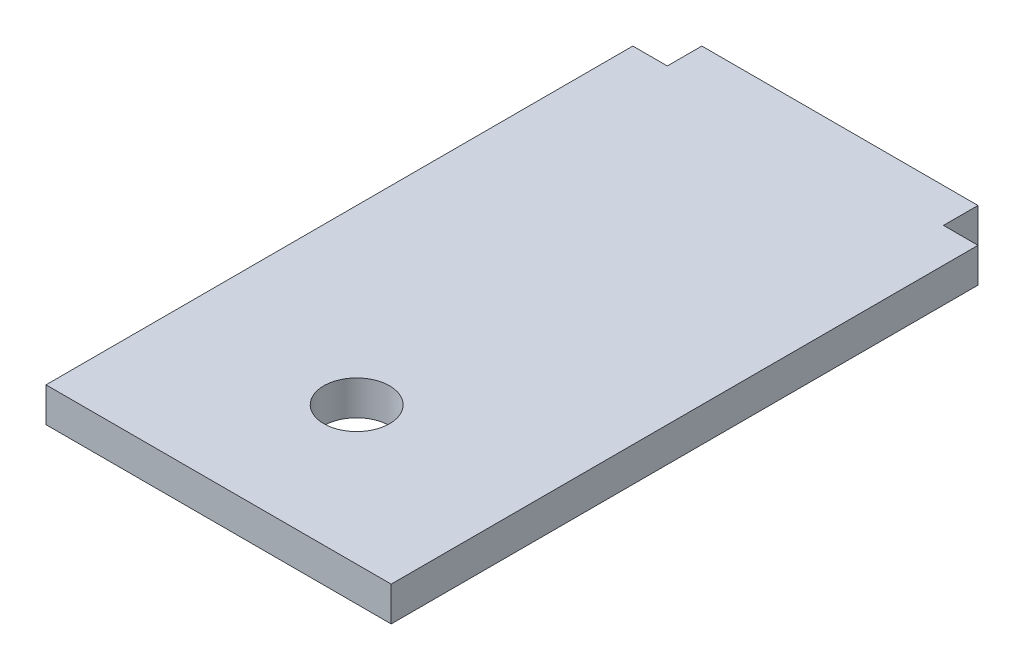
from build123d import *

# Parameters (mm, degrees)
SKETCH1_R    = 4.7625
HAMMER_DEPTH = 5


with BuildPart() as part:
    # Sketch1 → Hammer (new body)
    with BuildSketch(Plane(origin=(0, 0, 0), x_dir=(1, 0, 0), z_dir=(0, 1, 0))):
        Polygon((0, 85), (5, 85), (5, 90), (45, 90), (45, 85), (50, 85), (50, 0), (0, 0), align=None)
        with Locations((25, 20)):
            Circle(SKETCH1_R, mode=Mode.SUBTRACT)
    extrude(amount=HAMMER_DEPTH)


solid = part.part
